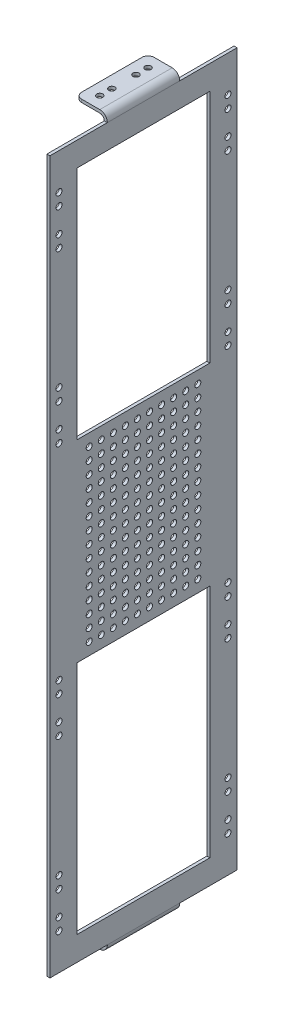
from build123d import *

# Parameters (mm, degrees)
SKETCH1_W              = 95.25
SKETCH1_H              = 374.65
MAINPLATEEXTRUDE_DEPTH = 1.5875
SKETCH4_W              = 69.85
SKETCH4_H              = 349.25
WALLOPENING_DEPTH      = 1.5875
SKETCH5_W              = 69.85
SKETCH5_H              = 101.6
SKETCH5_R              = 1.5875
ANTENNAEMOUNT_DEPTH    = 1.5875
BOSS_EXTRUDE1_DEPTH    = 19.05
MIRROR2_COPY_1_DEPTH   = 19.05
FILLET1_R              = 3.175
SKETCH8_R              = 1.5875
CUT_EXTRUDE1_DEPTH     = 382.905
SKETCH9_R              = 1.5875
CUT_EXTRUDE2_DEPTH     = 25.4
SKETCH10_W             = 1.5875
SKETCH10_H             = 374.65
BOSS_EXTRUDE2_DEPTH    = 1.5875


with BuildPart() as part:
    # Sketch1 → MainPlateExtrude (new body)
    with BuildSketch(Plane(origin=(0, 0, 0), x_dir=(0, 0, -1), z_dir=(1, 0, 0))):
        with Locations((47.625, 187.325)):
            Rectangle(SKETCH1_W, SKETCH1_H)
    extrude(amount=MAINPLATEEXTRUDE_DEPTH)

    # Sketch4 → WallOpening (cut)
    with BuildSketch(Plane.ZY):
        with Locations((-47.625, 187.325)):
            Rectangle(SKETCH4_W, SKETCH4_H)
    extrude(amount=-WALLOPENING_DEPTH, mode=Mode.SUBTRACT)

    # Sketch5 → AntennaeMount (add)
    with BuildSketch(Plane.ZY):
        with Locations((-47.625, 187.325)):
            Rectangle(SKETCH5_W, SKETCH5_H)
        with Locations((-76.2, 231.775)):
            Circle(SKETCH5_R, mode=Mode.SUBTRACT)
        with Locations((-69.85, 231.775)):
            Circle(SKETCH5_R, mode=Mode.SUBTRACT)
        with Locations((-63.5, 231.775)):
            Circle(SKETCH5_R, mode=Mode.SUBTRACT)
        with Locations((-57.15, 231.775)):
            Circle(SKETCH5_R, mode=Mode.SUBTRACT)
        with Locations((-50.8, 231.775)):
            Circle(SKETCH5_R, mode=Mode.SUBTRACT)
        with Locations((-44.45, 231.775)):
            Circle(SKETCH5_R, mode=Mode.SUBTRACT)
        with Locations((-38.1, 231.775)):
            Circle(SKETCH5_R, mode=Mode.SUBTRACT)
        with Locations((-31.75, 231.775)):
            Circle(SKETCH5_R, mode=Mode.SUBTRACT)
        with Locations((-25.4, 231.775)):
            Circle(SKETCH5_R, mode=Mode.SUBTRACT)
        with Locations((-19.05, 231.775)):
            Circle(SKETCH5_R, mode=Mode.SUBTRACT)
        with Locations((-69.85, 225.425)):
            Circle(SKETCH5_R, mode=Mode.SUBTRACT)
        with Locations((-63.5, 225.425)):
            Circle(SKETCH5_R, mode=Mode.SUBTRACT)
        with Locations((-57.15, 225.425)):
            Circle(SKETCH5_R, mode=Mode.SUBTRACT)
        with Locations((-50.8, 225.425)):
            Circle(SKETCH5_R, mode=Mode.SUBTRACT)
        with Locations((-44.45, 225.425)):
            Circle(SKETCH5_R, mode=Mode.SUBTRACT)
        with Locations((-38.1, 225.425)):
            Circle(SKETCH5_R, mode=Mode.SUBTRACT)
        with Locations((-31.75, 225.425)):
            Circle(SKETCH5_R, mode=Mode.SUBTRACT)
        with Locations((-25.4, 225.425)):
            Circle(SKETCH5_R, mode=Mode.SUBTRACT)
        with Locations((-19.05, 225.425)):
            Circle(SKETCH5_R, mode=Mode.SUBTRACT)
        with Locations((-69.85, 219.075)):
            Circle(SKETCH5_R, mode=Mode.SUBTRACT)
        with Locations((-63.5, 219.075)):
            Circle(SKETCH5_R, mode=Mode.SUBTRACT)
        with Locations((-57.15, 219.075)):
            Circle(SKETCH5_R, mode=Mode.SUBTRACT)
        with Locations((-50.8, 219.075)):
            Circle(SKETCH5_R, mode=Mode.SUBTRACT)
        with Locations((-44.45, 219.075)):
            Circle(SKETCH5_R, mode=Mode.SUBTRACT)
        with Locations((-38.1, 219.075)):
            Circle(SKETCH5_R, mode=Mode.SUBTRACT)
        with Locations((-31.75, 219.075)):
            Circle(SKETCH5_R, mode=Mode.SUBTRACT)
        with Locations((-25.4, 219.075)):
            Circle(SKETCH5_R, mode=Mode.SUBTRACT)
        with Locations((-19.05, 219.075)):
            Circle(SKETCH5_R, mode=Mode.SUBTRACT)
        with Locations((-69.85, 212.725)):
            Circle(SKETCH5_R, mode=Mode.SUBTRACT)
        with Locations((-63.5, 212.725)):
            Circle(SKETCH5_R, mode=Mode.SUBTRACT)
        with Locations((-57.15, 212.725)):
            Circle(SKETCH5_R, mode=Mode.SUBTRACT)
        with Locations((-50.8, 212.725)):
            Circle(SKETCH5_R, mode=Mode.SUBTRACT)
        with Locations((-44.45, 212.725)):
            Circle(SKETCH5_R, mode=Mode.SUBTRACT)
        with Locations((-38.1, 212.725)):
            Circle(SKETCH5_R, mode=Mode.SUBTRACT)
        with Locations((-31.75, 212.725)):
            Circle(SKETCH5_R, mode=Mode.SUBTRACT)
        with Locations((-25.4, 212.725)):
            Circle(SKETCH5_R, mode=Mode.SUBTRACT)
        with Locations((-19.05, 212.725)):
            Circle(SKETCH5_R, mode=Mode.SUBTRACT)
        with Locations((-69.85, 206.375)):
            Circle(SKETCH5_R, mode=Mode.SUBTRACT)
        with Locations((-63.5, 206.375)):
            Circle(SKETCH5_R, mode=Mode.SUBTRACT)
        with Locations((-57.15, 206.375)):
            Circle(SKETCH5_R, mode=Mode.SUBTRACT)
        with Locations((-50.8, 206.375)):
            Circle(SKETCH5_R, mode=Mode.SUBTRACT)
        with Locations((-44.45, 206.375)):
            Circle(SKETCH5_R, mode=Mode.SUBTRACT)
        with Locations((-38.1, 206.375)):
            Circle(SKETCH5_R, mode=Mode.SUBTRACT)
        with Locations((-31.75, 206.375)):
            Circle(SKETCH5_R, mode=Mode.SUBTRACT)
        with Locations((-25.4, 206.375)):
            Circle(SKETCH5_R, mode=Mode.SUBTRACT)
        with Locations((-19.05, 206.375)):
            Circle(SKETCH5_R, mode=Mode.SUBTRACT)
        with Locations((-69.85, 200.025)):
            Circle(SKETCH5_R, mode=Mode.SUBTRACT)
        with Locations((-63.5, 200.025)):
            Circle(SKETCH5_R, mode=Mode.SUBTRACT)
        with Locations((-57.15, 200.025)):
            Circle(SKETCH5_R, mode=Mode.SUBTRACT)
        with Locations((-50.8, 200.025)):
            Circle(SKETCH5_R, mode=Mode.SUBTRACT)
        with Locations((-44.45, 200.025)):
            Circle(SKETCH5_R, mode=Mode.SUBTRACT)
        with Locations((-38.1, 200.025)):
            Circle(SKETCH5_R, mode=Mode.SUBTRACT)
        with Locations((-31.75, 200.025)):
            Circle(SKETCH5_R, mode=Mode.SUBTRACT)
        with Locations((-25.4, 200.025)):
            Circle(SKETCH5_R, mode=Mode.SUBTRACT)
        with Locations((-19.05, 200.025)):
            Circle(SKETCH5_R, mode=Mode.SUBTRACT)
        with Locations((-69.85, 193.675)):
            Circle(SKETCH5_R, mode=Mode.SUBTRACT)
        with Locations((-63.5, 193.675)):
            Circle(SKETCH5_R, mode=Mode.SUBTRACT)
        with Locations((-57.15, 193.675)):
            Circle(SKETCH5_R, mode=Mode.SUBTRACT)
        with Locations((-50.8, 193.675)):
            Circle(SKETCH5_R, mode=Mode.SUBTRACT)
        with Locations((-44.45, 193.675)):
            Circle(SKETCH5_R, mode=Mode.SUBTRACT)
        with Locations((-38.1, 193.675)):
            Circle(SKETCH5_R, mode=Mode.SUBTRACT)
        with Locations((-31.75, 193.675)):
            Circle(SKETCH5_R, mode=Mode.SUBTRACT)
        with Locations((-25.4, 193.675)):
            Circle(SKETCH5_R, mode=Mode.SUBTRACT)
        with Locations((-19.05, 193.675)):
            Circle(SKETCH5_R, mode=Mode.SUBTRACT)
        with Locations((-69.85, 187.325)):
            Circle(SKETCH5_R, mode=Mode.SUBTRACT)
        with Locations((-63.5, 187.325)):
            Circle(SKETCH5_R, mode=Mode.SUBTRACT)
        with Locations((-57.15, 187.325)):
            Circle(SKETCH5_R, mode=Mode.SUBTRACT)
        with Locations((-50.8, 187.325)):
            Circle(SKETCH5_R, mode=Mode.SUBTRACT)
        with Locations((-44.45, 187.325)):
            Circle(SKETCH5_R, mode=Mode.SUBTRACT)
        with Locations((-38.1, 187.325)):
            Circle(SKETCH5_R, mode=Mode.SUBTRACT)
        with Locations((-31.75, 187.325)):
            Circle(SKETCH5_R, mode=Mode.SUBTRACT)
        with Locations((-25.4, 187.325)):
            Circle(SKETCH5_R, mode=Mode.SUBTRACT)
        with Locations((-19.05, 187.325)):
            Circle(SKETCH5_R, mode=Mode.SUBTRACT)
        with Locations((-69.85, 180.975)):
            Circle(SKETCH5_R, mode=Mode.SUBTRACT)
        with Locations((-63.5, 180.975)):
            Circle(SKETCH5_R, mode=Mode.SUBTRACT)
        with Locations((-57.15, 180.975)):
            Circle(SKETCH5_R, mode=Mode.SUBTRACT)
        with Locations((-50.8, 180.975)):
            Circle(SKETCH5_R, mode=Mode.SUBTRACT)
        with Locations((-44.45, 180.975)):
            Circle(SKETCH5_R, mode=Mode.SUBTRACT)
        with Locations((-38.1, 180.975)):
            Circle(SKETCH5_R, mode=Mode.SUBTRACT)
        with Locations((-31.75, 180.975)):
            Circle(SKETCH5_R, mode=Mode.SUBTRACT)
        with Locations((-25.4, 180.975)):
            Circle(SKETCH5_R, mode=Mode.SUBTRACT)
        with Locations((-19.05, 180.975)):
            Circle(SKETCH5_R, mode=Mode.SUBTRACT)
        with Locations((-69.85, 174.625)):
            Circle(SKETCH5_R, mode=Mode.SUBTRACT)
        with Locations((-63.5, 174.625)):
            Circle(SKETCH5_R, mode=Mode.SUBTRACT)
        with Locations((-57.15, 174.625)):
            Circle(SKETCH5_R, mode=Mode.SUBTRACT)
        with Locations((-50.8, 174.625)):
            Circle(SKETCH5_R, mode=Mode.SUBTRACT)
        with Locations((-44.45, 174.625)):
            Circle(SKETCH5_R, mode=Mode.SUBTRACT)
        with Locations((-38.1, 174.625)):
            Circle(SKETCH5_R, mode=Mode.SUBTRACT)
        with Locations((-31.75, 174.625)):
            Circle(SKETCH5_R, mode=Mode.SUBTRACT)
        with Locations((-25.4, 174.625)):
            Circle(SKETCH5_R, mode=Mode.SUBTRACT)
        with Locations((-19.05, 174.625)):
            Circle(SKETCH5_R, mode=Mode.SUBTRACT)
        with Locations((-69.85, 168.275)):
            Circle(SKETCH5_R, mode=Mode.SUBTRACT)
        with Locations((-63.5, 168.275)):
            Circle(SKETCH5_R, mode=Mode.SUBTRACT)
        with Locations((-57.15, 168.275)):
            Circle(SKETCH5_R, mode=Mode.SUBTRACT)
        with Locations((-50.8, 168.275)):
            Circle(SKETCH5_R, mode=Mode.SUBTRACT)
        with Locations((-44.45, 168.275)):
            Circle(SKETCH5_R, mode=Mode.SUBTRACT)
        with Locations((-38.1, 168.275)):
            Circle(SKETCH5_R, mode=Mode.SUBTRACT)
        with Locations((-31.75, 168.275)):
            Circle(SKETCH5_R, mode=Mode.SUBTRACT)
        with Locations((-25.4, 168.275)):
            Circle(SKETCH5_R, mode=Mode.SUBTRACT)
        with Locations((-19.05, 168.275)):
            Circle(SKETCH5_R, mode=Mode.SUBTRACT)
        with Locations((-69.85, 161.925)):
            Circle(SKETCH5_R, mode=Mode.SUBTRACT)
        with Locations((-63.5, 161.925)):
            Circle(SKETCH5_R, mode=Mode.SUBTRACT)
        with Locations((-57.15, 161.925)):
            Circle(SKETCH5_R, mode=Mode.SUBTRACT)
        with Locations((-50.8, 161.925)):
            Circle(SKETCH5_R, mode=Mode.SUBTRACT)
        with Locations((-44.45, 161.925)):
            Circle(SKETCH5_R, mode=Mode.SUBTRACT)
        with Locations((-38.1, 161.925)):
            Circle(SKETCH5_R, mode=Mode.SUBTRACT)
        with Locations((-31.75, 161.925)):
            Circle(SKETCH5_R, mode=Mode.SUBTRACT)
        with Locations((-25.4, 161.925)):
            Circle(SKETCH5_R, mode=Mode.SUBTRACT)
        with Locations((-19.05, 161.925)):
            Circle(SKETCH5_R, mode=Mode.SUBTRACT)
        with Locations((-69.85, 155.575)):
            Circle(SKETCH5_R, mode=Mode.SUBTRACT)
        with Locations((-63.5, 155.575)):
            Circle(SKETCH5_R, mode=Mode.SUBTRACT)
        with Locations((-57.15, 155.575)):
            Circle(SKETCH5_R, mode=Mode.SUBTRACT)
        with Locations((-50.8, 155.575)):
            Circle(SKETCH5_R, mode=Mode.SUBTRACT)
        with Locations((-44.45, 155.575)):
            Circle(SKETCH5_R, mode=Mode.SUBTRACT)
        with Locations((-38.1, 155.575)):
            Circle(SKETCH5_R, mode=Mode.SUBTRACT)
        with Locations((-31.75, 155.575)):
            Circle(SKETCH5_R, mode=Mode.SUBTRACT)
        with Locations((-25.4, 155.575)):
            Circle(SKETCH5_R, mode=Mode.SUBTRACT)
        with Locations((-19.05, 155.575)):
            Circle(SKETCH5_R, mode=Mode.SUBTRACT)
        with Locations((-69.85, 149.225)):
            Circle(SKETCH5_R, mode=Mode.SUBTRACT)
        with Locations((-63.5, 149.225)):
            Circle(SKETCH5_R, mode=Mode.SUBTRACT)
        with Locations((-57.15, 149.225)):
            Circle(SKETCH5_R, mode=Mode.SUBTRACT)
        with Locations((-50.8, 149.225)):
            Circle(SKETCH5_R, mode=Mode.SUBTRACT)
        with Locations((-44.45, 149.225)):
            Circle(SKETCH5_R, mode=Mode.SUBTRACT)
        with Locations((-38.1, 149.225)):
            Circle(SKETCH5_R, mode=Mode.SUBTRACT)
        with Locations((-31.75, 149.225)):
            Circle(SKETCH5_R, mode=Mode.SUBTRACT)
        with Locations((-25.4, 149.225)):
            Circle(SKETCH5_R, mode=Mode.SUBTRACT)
        with Locations((-19.05, 149.225)):
            Circle(SKETCH5_R, mode=Mode.SUBTRACT)
        with Locations((-69.85, 142.875)):
            Circle(SKETCH5_R, mode=Mode.SUBTRACT)
        with Locations((-63.5, 142.875)):
            Circle(SKETCH5_R, mode=Mode.SUBTRACT)
        with Locations((-57.15, 142.875)):
            Circle(SKETCH5_R, mode=Mode.SUBTRACT)
        with Locations((-50.8, 142.875)):
            Circle(SKETCH5_R, mode=Mode.SUBTRACT)
        with Locations((-44.45, 142.875)):
            Circle(SKETCH5_R, mode=Mode.SUBTRACT)
        with Locations((-38.1, 142.875)):
            Circle(SKETCH5_R, mode=Mode.SUBTRACT)
        with Locations((-31.75, 142.875)):
            Circle(SKETCH5_R, mode=Mode.SUBTRACT)
        with Locations((-25.4, 142.875)):
            Circle(SKETCH5_R, mode=Mode.SUBTRACT)
        with Locations((-19.05, 142.875)):
            Circle(SKETCH5_R, mode=Mode.SUBTRACT)
        with Locations((-76.2, 225.425)):
            Circle(SKETCH5_R, mode=Mode.SUBTRACT)
        with Locations((-76.2, 219.075)):
            Circle(SKETCH5_R, mode=Mode.SUBTRACT)
        with Locations((-76.2, 212.725)):
            Circle(SKETCH5_R, mode=Mode.SUBTRACT)
        with Locations((-76.2, 206.375)):
            Circle(SKETCH5_R, mode=Mode.SUBTRACT)
        with Locations((-76.2, 200.025)):
            Circle(SKETCH5_R, mode=Mode.SUBTRACT)
        with Locations((-76.2, 193.675)):
            Circle(SKETCH5_R, mode=Mode.SUBTRACT)
        with Locations((-76.2, 187.325)):
            Circle(SKETCH5_R, mode=Mode.SUBTRACT)
        with Locations((-76.2, 180.975)):
            Circle(SKETCH5_R, mode=Mode.SUBTRACT)
        with Locations((-76.2, 174.625)):
            Circle(SKETCH5_R, mode=Mode.SUBTRACT)
        with Locations((-76.2, 168.275)):
            Circle(SKETCH5_R, mode=Mode.SUBTRACT)
        with Locations((-76.2, 161.925)):
            Circle(SKETCH5_R, mode=Mode.SUBTRACT)
        with Locations((-76.2, 155.575)):
            Circle(SKETCH5_R, mode=Mode.SUBTRACT)
        with Locations((-76.2, 149.225)):
            Circle(SKETCH5_R, mode=Mode.SUBTRACT)
        with Locations((-76.2, 142.875)):
            Circle(SKETCH5_R, mode=Mode.SUBTRACT)
    extrude(amount=-ANTENNAEMOUNT_DEPTH)

    # Sketch7 → Boss-Extrude1 (add)
    with BuildSketch(Plane(origin=(0, 0, -47.625), x_dir=(-1, 0, 0), z_dir=(0, 0, -1))):
        with BuildLine():
            Line((0, 374.65), (-1.5875, 374.65))
            ThreePointArc((-1.5875, 374.65), (-0.425080038, 377.456330038), (2.38125, 378.61875))
            Line((2.38125, 378.61875), (15.08125, 378.61875))
            Line((15.08125, 378.61875), (15.08125, 377.03125))
            Line((15.08125, 377.03125), (2.38125, 377.03125))
            ThreePointArc((2.38125, 377.03125), (0.697451977, 376.333798023), (0, 374.65))
        make_face()
    boss_extrude1 = extrude(amount=BOSS_EXTRUDE1_DEPTH)

    # Mirror1: Boss-Extrude1 across plane
    add(boss_extrude1.mirror(Plane(origin=(0, 0, -47.625), x_dir=(1, 0, 0), z_dir=(0, 0, -1))))

    # Mirror2: Boss-Extrude1 across plane
    add(boss_extrude1.mirror(Plane.ZX.offset(187.325)))

    # Mirror2 copy 1 sketch → Mirror2 copy 1 (add)
    with BuildSketch(Plane(origin=(0, 374.65, -47.625), x_dir=(-1, 0, 0), z_dir=(0, 0, 1))):
        with BuildLine():
            Line((0, 374.65), (-1.5875, 374.65))
            ThreePointArc((-1.5875, 374.65), (-0.425080038, 377.456330038), (2.38125, 378.61875))
            Line((2.38125, 378.61875), (15.08125, 378.61875))
            Line((15.08125, 378.61875), (15.08125, 377.03125))
            Line((15.08125, 377.03125), (2.38125, 377.03125))
            ThreePointArc((2.38125, 377.03125), (0.697451977, 376.333798023), (0, 374.65))
        make_face()
    extrude(amount=MIRROR2_COPY_1_DEPTH)

    # Fillet1
    fillet1_edges = [part.edges().sort_by_distance(p)[0] for p in [
        (-15.08125, 377.825, -28.575),
        (-15.08125, 377.825, -66.675),
        (-15.08125, -3.175, -28.575),
        (-15.08125, -3.175, -66.675),
    ]]
    fillet(fillet1_edges, radius=FILLET1_R)

    # Sketch8 → Cut-Extrude1 (cut)
    with BuildSketch(Plane(origin=(0, 378.61875, 0), x_dir=(1, 0, 0), z_dir=(0, 1, 0))):
        with Locations((-8.73125, 34.925)):
            Circle(SKETCH8_R)
        with Locations((-8.73125, 41.275)):
            Circle(SKETCH8_R)
        with Locations((-8.73125, 53.975)):
            Circle(SKETCH8_R)
        with Locations((-8.73125, 60.325)):
            Circle(SKETCH8_R)
    extrude(amount=-CUT_EXTRUDE1_DEPTH, mode=Mode.SUBTRACT)

    # Sketch9 → Cut-Extrude2 (cut)
    with BuildSketch(Plane(origin=(1.5875, 0, 0), x_dir=(0, 0, -1), z_dir=(1, 0, 0))):
        with Locations((3.175, 355.6)):
            Circle(SKETCH9_R)
        with Locations((3.175, 349.25)):
            Circle(SKETCH9_R)
        with Locations((3.175, 336.55)):
            Circle(SKETCH9_R)
        with Locations((3.175, 330.2)):
            Circle(SKETCH9_R)
        with Locations((3.175, 247.65)):
            Circle(SKETCH9_R)
        with Locations((3.175, 241.3)):
            Circle(SKETCH9_R)
        with Locations((3.175, 266.7)):
            Circle(SKETCH9_R)
        with Locations((3.175, 260.35)):
            Circle(SKETCH9_R)
        with Locations((3.175, 127)):
            Circle(SKETCH9_R)
        with Locations((3.175, 133.35)):
            Circle(SKETCH9_R)
        with Locations((3.175, 107.95)):
            Circle(SKETCH9_R)
        with Locations((3.175, 114.3)):
            Circle(SKETCH9_R)
        with Locations((3.175, 25.4)):
            Circle(SKETCH9_R)
        with Locations((3.175, 19.05)):
            Circle(SKETCH9_R)
        with Locations((3.175, 38.1)):
            Circle(SKETCH9_R)
        with Locations((3.175, 44.45)):
            Circle(SKETCH9_R)
    cut_extrude2 = extrude(amount=-CUT_EXTRUDE2_DEPTH, mode=Mode.SUBTRACT)

    # Mirror3: Cut-Extrude2 across plane
    add(cut_extrude2.mirror(Plane.XY.offset(-47.625)), mode=Mode.SUBTRACT)

    # Sketch10 → Boss-Extrude2 (add)
    with BuildSketch(Plane.XY):
        with Locations((0.79375, 187.325)):
            Rectangle(SKETCH10_W, SKETCH10_H)
    boss_extrude2 = extrude(amount=BOSS_EXTRUDE2_DEPTH)

    # Mirror4: Boss-Extrude2 across plane
    add(boss_extrude2.mirror(Plane.XY.offset(-47.625)))


solid = part.part
